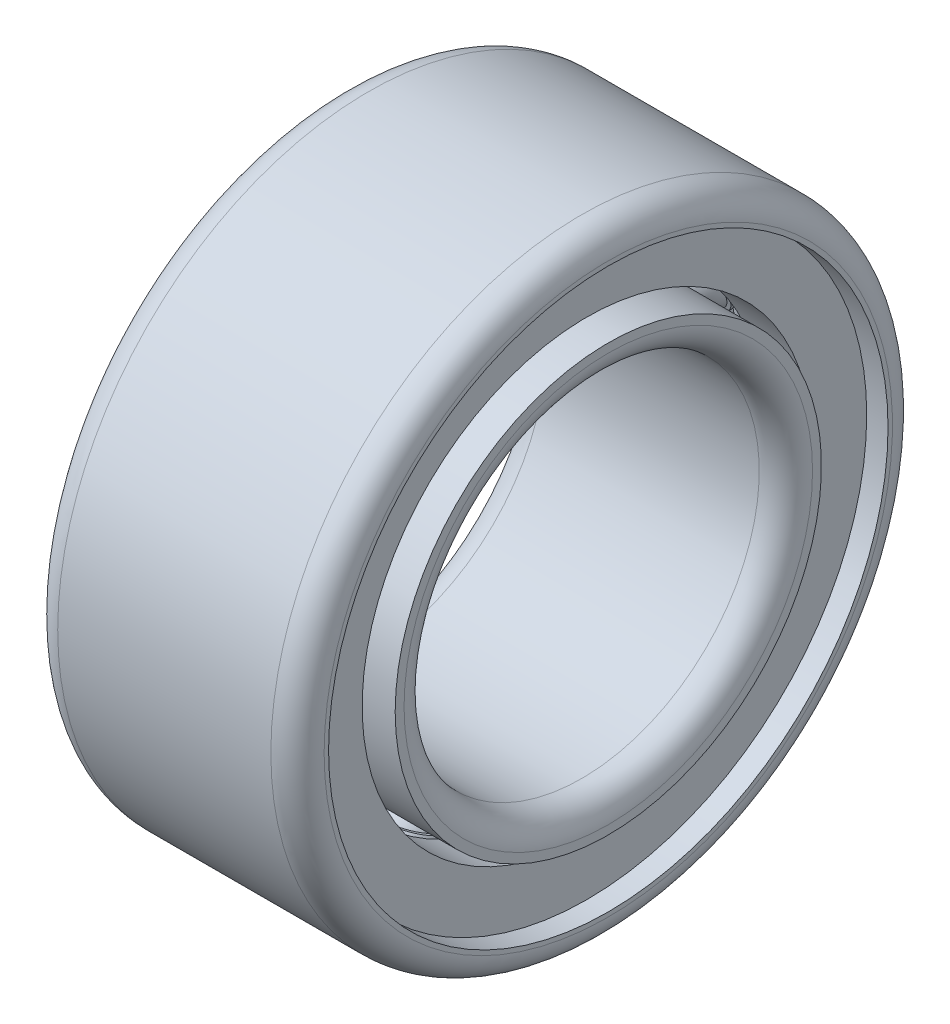
from build123d import *

# Parameters (mm, degrees)
SKETCH_2_W               = 0.176
SKETCH_2_H               = 0.22
PATTERN_CIRCULAR_1_COUNT = 11
SKETCH_4_W               = 0.88
SKETCH_4_H               = 0.44
SKETCH_5_W               = 0.88
SKETCH_5_H               = 0.44
PATTERN_CIRCULAR_2_COUNT = 11
SKETCH_10_W              = 0.535202389
SKETCH_10_H              = 0.568
SKETCH_11_R              = 3.5
CUT_EXTRUDE_1_DEPTH      = 10


with BuildPart() as part:
    # 草图2 → Revolve 392 (revolve)
    with BuildSketch(Plane.XY):
        with Locations((0, 2.775)):
            Rectangle(SKETCH_2_W, SKETCH_2_H)
    revolve(axis=Axis((-12.420610377, 0, 0), (1, 0, 0)))

    # 草图3 → 凸台-旋转1 (revolve)
    with BuildSketch(Plane.XY):
        with BuildLine():
            Line((-0.44, 2.775), (0.44, 2.775))
            ThreePointArc((0.44, 2.775), (0, 2.335), (-0.44, 2.775))
        make_face()
    revolve_1 = revolve(axis=Axis((-5.568093779, 2.775, 0), (1, 0, 0)))

    # 阵列(圆周)1: 凸台-旋转1 ×11 about axis
    pattern_circular_1_axis = Axis((-12.420610377, 0, 0), (1, 0, 0))
    for i in range(1, PATTERN_CIRCULAR_1_COUNT):
        add(revolve_1.rotate(pattern_circular_1_axis, i * 360 / PATTERN_CIRCULAR_1_COUNT))

    # 草图4 → 切除-旋转1 (revolve, cut)
    with BuildSketch(Plane.XY):
        with Locations((0, 3.105)):
            Rectangle(SKETCH_4_W, SKETCH_4_H)
    revolve(axis=Axis((0, 0, 0), (1, 0, 0)), mode=Mode.SUBTRACT)

    # 草图5 → 切除-旋转2 (revolve, cut)
    with BuildSketch(Plane.XY):
        with Locations((0, 2.445)):
            Rectangle(SKETCH_5_W, SKETCH_5_H)
    revolve(axis=Axis((0, 0, 0), (1, 0, 0)), mode=Mode.SUBTRACT)

    # 草图6 → 凸台-旋转2 (revolve)
    with BuildSketch(Plane.XY):
        with BuildLine():
            Line((-0.4, 2.775), (0.4, 2.775))
            ThreePointArc((0.4, 2.775), (0, 2.375), (-0.4, 2.775))
        make_face()
    revolve_2 = revolve(axis=Axis((-5.568093779, 2.775, 0), (1, 0, 0)))

    # 阵列(圆周)2: 凸台-旋转2 ×11 about axis
    pattern_circular_2_axis = Axis((-12.420610377, 0, 0), (1, 0, 0))
    for i in range(1, PATTERN_CIRCULAR_2_COUNT):
        add(revolve_2.rotate(pattern_circular_2_axis, i * 360 / PATTERN_CIRCULAR_2_COUNT))

    # 草图7 → 凸台-旋转3 (revolve)
    with BuildSketch(Plane.XY):
        with BuildLine():
            Line((-1.2, 3.5), (1.2, 3.5))
            ThreePointArc((1.2, 3.5), (1.412132034, 3.412132034), (1.5, 3.2))
            Line((1.5, 3.2), (1.5, 3.15))
            Line((1.5, 3.15), (1.26, 3.15))
            Line((1.26, 3.15), (1.26, 3.1))
            Line((1.26, 3.1), (0.724797611, 3.1))
            Line((0.724797611, 3.1), (0.724797611, 3.15))
            Line((0.724797611, 3.15), (0.107121426, 3.15))
            ThreePointArc((0.107121426, 3.15), (0, 3.165), (-0.107121426, 3.15))
            Line((-0.107121426, 3.15), (-1.5, 3.15))
            Line((-1.5, 3.15), (-1.5, 3.2))
            ThreePointArc((-1.5, 3.2), (-1.412132034, 3.412132034), (-1.2, 3.5))
        make_face()
    revolve(axis=Axis((0, 0, 0), (1, 0, 0)))

    # 草图8 → 凸台-旋转4 (revolve)
    with BuildSketch(Plane.XY):
        with BuildLine():
            Line((-1.5, 2.4), (-0.107121426, 2.4))
            ThreePointArc((-0.107121426, 2.4), (0, 2.385), (0.107121426, 2.4))
            Line((0.107121426, 2.4), (1.5, 2.4))
            Line((1.5, 2.4), (1.5, 2.3))
            ThreePointArc((1.5, 2.3), (1.412132034, 2.087867966), (1.2, 2))
            Line((1.2, 2), (-1.2, 2))
            ThreePointArc((-1.2, 2), (-1.412132034, 2.087867966), (-1.5, 2.3))
            Line((-1.5, 2.3), (-1.5, 2.4))
        make_face()
    revolve(axis=Axis((-12.420610377, 0, 0), (1, 0, 0)))

    # 草图10 → 凸台-旋转5 (revolve)
    with BuildSketch(Plane.XY):
        with Locations((0.992398806, 2.816)):
            Rectangle(SKETCH_10_W, SKETCH_10_H)
    revolve(axis=Axis((0, 0, 0), (-1, 0, 0)))

    # 草图11 → 切除-拉伸1 (cut)
    with BuildSketch(Plane(origin=(0, 0, 0), x_dir=(0, 0, -1), z_dir=(1, 0, 0))):
        Circle(SKETCH_11_R)
    extrude(amount=-CUT_EXTRUDE_1_DEPTH, mode=Mode.SUBTRACT)

    # 镜向所有1: part across plane


with BuildPart() as part_1:
    add(part.part)
    add(part.part.mirror(Plane(origin=(0, 0, 0), x_dir=(0, 0, 1), z_dir=(1, 0, 0))))


solid = part_1.part
